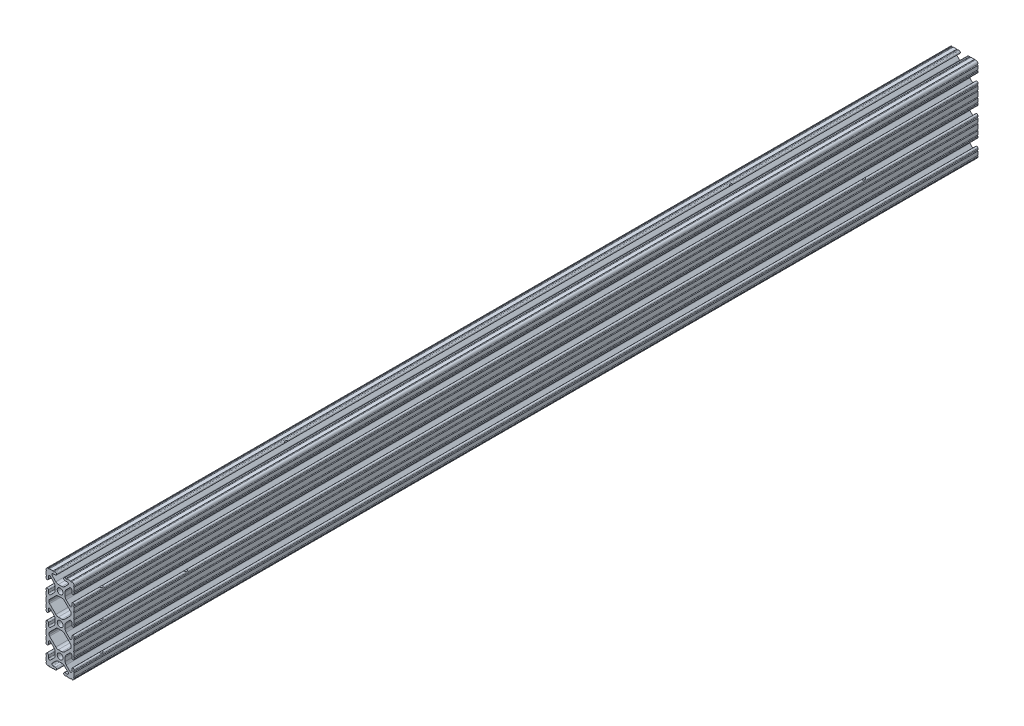
from build123d import *

# Parameters (mm, degrees)
SKETCH1_R               = 2.6035
BOSS_EXTRUDE1_DEPTH     = 406.4
CUT_EXTRUDE1_DEPTH      = 409.544636002
CUT_EXTRUDE1_DEPTH_BACK = 409.544636002
SKETCH2_R               = 3.5
CUT_EXTRUDE2_DEPTH      = 409.544636102
CUT_EXTRUDE2_DEPTH_BACK = 409.544636102
SKETCH3_R               = 3.5
CUT_EXTRUDE3_DEPTH      = 413.246808546
CUT_EXTRUDE3_DEPTH_BACK = 413.246808546
SKETCH4_R               = 3.5


with BuildPart() as part:
    # Sketch1 → Boss-Extrude1 (new, symmetric)
    with BuildSketch(Plane.XY):
        with BuildLine():
            Line((-12.7, 34.9504), (-12.7, 31.7246))
            ThreePointArc((-12.7, 31.7246), (-12.192, 31.2166), (-12.7, 30.7086))
            Line((-12.7, 30.7086), (-12.7, 29.702307889))
            ThreePointArc((-12.7, 29.702307889), (-11.5951, 28.597407889), (-10.4902, 29.702307889))
            Line((-10.4902, 29.702307889), (-10.4902, 31.874794456))
            ThreePointArc((-10.4902, 31.874794456), (-9.863006367, 32.813456061), (-8.75577951, 32.593214945))
            Line((-8.75577951, 32.593214945), (-5.43843597, 29.275871405))
            ThreePointArc((-5.43843597, 29.275871405), (-4.750182484, 28.245827272), (-4.5085, 27.030807374))
            Line((-4.5085, 27.030807374), (-4.5085, 23.769192626))
            ThreePointArc((-4.5085, 23.769192626), (-4.750182484, 22.554172728), (-5.43843597, 21.524128595))
            Line((-5.43843597, 21.524128595), (-8.75577951, 18.206785055))
            ThreePointArc((-8.75577951, 18.206785055), (-9.863006367, 17.986543939), (-10.4902, 18.925205544))
            Line((-10.4902, 18.925205544), (-10.4902, 21.097692111))
            ThreePointArc((-10.4902, 21.097692111), (-11.5951, 22.202592111), (-12.7, 21.097692111))
            Line((-12.7, 21.097692111), (-12.7, 20.0914))
            ThreePointArc((-12.7, 20.0914), (-12.192, 19.5834), (-12.7, 19.0754))
            Line((-12.7, 19.0754), (-12.7, 15.8496))
            ThreePointArc((-12.7, 15.8496), (-12.192, 15.3416), (-12.7, 14.8336))
            Line((-12.7, 14.8336), (-12.7, 10.5664))
            ThreePointArc((-12.7, 10.5664), (-12.192, 10.0584), (-12.7, 9.5504))
            Line((-12.7, 9.5504), (-12.7, 6.3246))
            ThreePointArc((-12.7, 6.3246), (-12.192000017, 5.8166), (-12.7, 5.3086))
            Line((-12.7, 5.3086), (-12.7, 4.302307889))
            ThreePointArc((-12.7, 4.302307889), (-11.5951, 3.197407889), (-10.4902, 4.302307889))
            Line((-10.4902, 4.302307889), (-10.4902, 6.474794456))
            ThreePointArc((-10.4902, 6.474794456), (-9.863006367, 7.413456061), (-8.75577951, 7.193214945))
            Line((-8.75577951, 7.193214945), (-5.43843597, 3.875871405))
            ThreePointArc((-5.43843597, 3.875871405), (-4.750182484, 2.845827272), (-4.5085, 1.630807374))
            Line((-4.5085, 1.630807374), (-4.5085, -1.630807374))
            ThreePointArc((-4.5085, -1.630807374), (-4.750182484, -2.845827272), (-5.43843597, -3.875871405))
            Line((-5.43843597, -3.875871405), (-8.75577951, -7.193214945))
            ThreePointArc((-8.75577951, -7.193214945), (-9.863006367, -7.413456061), (-10.4902, -6.474794456))
            Line((-10.4902, -6.474794456), (-10.4902, -4.302307889))
            ThreePointArc((-10.4902, -4.302307889), (-11.5951, -3.197407889), (-12.7, -4.302307889))
            Line((-12.7, -4.302307889), (-12.7, -5.3086))
            ThreePointArc((-12.7, -5.3086), (-12.191999983, -5.8166), (-12.7, -6.3246))
            Line((-12.7, -6.3246), (-12.7, -9.5504))
            ThreePointArc((-12.7, -9.5504), (-12.192, -10.0584), (-12.7, -10.5664))
            Line((-12.7, -10.5664), (-12.7, -14.8336))
            ThreePointArc((-12.7, -14.8336), (-12.192, -15.3416), (-12.7, -15.8496))
            Line((-12.7, -15.8496), (-12.7, -19.0754))
            ThreePointArc((-12.7, -19.0754), (-12.192, -19.5834), (-12.7, -20.0914))
            Line((-12.7, -20.0914), (-12.7, -21.097692111))
            ThreePointArc((-12.7, -21.097692111), (-11.5951, -22.202592111), (-10.4902, -21.097692111))
            Line((-10.4902, -21.097692111), (-10.4902, -18.925205544))
            ThreePointArc((-10.4902, -18.925205544), (-9.863006367, -17.986543939), (-8.75577951, -18.206785055))
            Line((-8.75577951, -18.206785055), (-5.43843597, -21.524128595))
            ThreePointArc((-5.43843597, -21.524128595), (-4.750182484, -22.554172728), (-4.5085, -23.769192626))
            Line((-4.5085, -23.769192626), (-4.5085, -27.030807374))
            ThreePointArc((-4.5085, -27.030807374), (-4.750182484, -28.245827272), (-5.43843597, -29.275871405))
            Line((-5.43843597, -29.275871405), (-8.75577951, -32.593214945))
            ThreePointArc((-8.75577951, -32.593214945), (-9.863006367, -32.813456061), (-10.4902, -31.874794456))
            Line((-10.4902, -31.874794456), (-10.4902, -29.702307889))
            ThreePointArc((-10.4902, -29.702307889), (-11.5951, -28.597407889), (-12.7, -29.702307889))
            Line((-12.7, -29.702307889), (-12.7, -30.7086))
            ThreePointArc((-12.7, -30.7086), (-12.192, -31.2166), (-12.7, -31.7246))
            Line((-12.7, -31.7246), (-12.7, -34.9504))
            ThreePointArc((-12.7, -34.9504), (-12.192, -35.4584), (-12.7, -35.9664))
            ThreePointArc((-12.7, -35.9664), (-12.082677406, -37.482677406), (-10.5664, -38.1))
            ThreePointArc((-10.5664, -38.1), (-10.0584, -37.592), (-9.5504, -38.1))
            Line((-9.5504, -38.1), (-6.3246, -38.1))
            ThreePointArc((-6.3246, -38.1), (-5.816599996, -37.592000017), (-5.3086, -38.100000008))
            Line((-5.3086, -38.100000008), (-4.302307889, -38.100000008))
            ThreePointArc((-4.302307889, -38.100000008), (-3.197407889, -36.995100008), (-4.302307889, -35.890200008))
            Line((-4.302307889, -35.890200008), (-6.474794456, -35.890200008))
            ThreePointArc((-6.474794456, -35.890200008), (-7.413456061, -35.263006376), (-7.193214945, -34.155779519))
            Line((-7.193214945, -34.155779519), (-3.875871405, -30.838435978))
            ThreePointArc((-3.875871405, -30.838435978), (-2.845827272, -30.150182493), (-1.630807374, -29.908500008))
            Line((-1.630807374, -29.908500008), (1.630807374, -29.908500008))
            ThreePointArc((1.630807374, -29.908500008), (2.845827272, -30.150182493), (3.875871405, -30.838435978))
            Line((3.875871405, -30.838435978), (7.193214945, -34.155779519))
            ThreePointArc((7.193214945, -34.155779519), (7.413456061, -35.263006376), (6.474794456, -35.890200008))
            Line((6.474794456, -35.890200008), (4.302307889, -35.890200008))
            ThreePointArc((4.302307889, -35.890200008), (3.197407889, -36.995100008), (4.302307889, -38.100000008))
            Line((4.302307889, -38.100000008), (5.3086, -38.100000008))
            ThreePointArc((5.3086, -38.100000008), (5.8166, -37.591999992), (6.3246, -38.100000008))
            Line((6.3246, -38.100000008), (9.5504, -38.100000008))
            ThreePointArc((9.5504, -38.100000008), (10.0584, -37.592000008), (10.5664, -38.100000008))
            ThreePointArc((10.5664, -38.100000008), (12.082677406, -37.482677414), (12.7, -35.966400008))
            ThreePointArc((12.7, -35.966400008), (12.192, -35.458400008), (12.7, -34.950400008))
            Line((12.7, -34.950400008), (12.7, -31.724600008))
            ThreePointArc((12.7, -31.724600008), (12.192, -31.216600008), (12.7, -30.708600008))
            Line((12.7, -30.708600008), (12.7, -29.702307926))
            ThreePointArc((12.7, -29.702307926), (11.5951, -28.597407926), (10.4902, -29.702307926))
            Line((10.4902, -29.702307926), (10.4902, -31.874794464))
            ThreePointArc((10.4902, -31.874794464), (9.863006367, -32.813456069), (8.75577951, -32.593214954))
            Line((8.75577951, -32.593214954), (5.43843597, -29.275871413))
            ThreePointArc((5.43843597, -29.275871413), (4.750182484, -28.245827281), (4.5085, -27.030807383))
            Line((4.5085, -27.030807383), (4.5085, -23.769192634))
            ThreePointArc((4.5085, -23.769192634), (4.750182484, -22.554172736), (5.43843597, -21.524128604))
            Line((5.43843597, -21.524128604), (8.75577951, -18.206785063))
            ThreePointArc((8.75577951, -18.206785063), (9.863006367, -17.986543948), (10.4902, -18.925205553))
            Line((10.4902, -18.925205553), (10.4902, -21.097692067))
            ThreePointArc((10.4902, -21.097692067), (11.5951, -22.202592067), (12.7, -21.097692067))
            Line((12.7, -21.097692067), (12.7, -20.091400008))
            ThreePointArc((12.7, -20.091400008), (12.192, -19.583400008), (12.7, -19.075400008))
            Line((12.7, -19.075400008), (12.7, -15.849600008))
            ThreePointArc((12.7, -15.849600008), (12.192, -15.341600008), (12.7, -14.833600008))
            Line((12.7, -14.833600008), (12.7, -10.566400008))
            ThreePointArc((12.7, -10.566400008), (12.192, -10.058400008), (12.7, -9.550400008))
            Line((12.7, -9.550400008), (12.7, -6.324600008))
            ThreePointArc((12.7, -6.324600008), (12.192000017, -5.816600008), (12.7, -5.308600008))
            Line((12.7, -5.308600008), (12.7, -4.302307897))
            ThreePointArc((12.7, -4.302307897), (11.5951, -3.197407897), (10.4902, -4.302307897))
            Line((10.4902, -4.302307897), (10.4902, -6.474794464))
            ThreePointArc((10.4902, -6.474794464), (9.863006367, -7.413456069), (8.75577951, -7.193214954))
            Line((8.75577951, -7.193214954), (5.43843597, -3.875871413))
            ThreePointArc((5.43843597, -3.875871413), (4.750182484, -2.845827281), (4.5085, -1.630807383))
            Line((4.5085, -1.630807383), (4.5085, 1.630807366))
            ThreePointArc((4.5085, 1.630807366), (4.750182484, 2.845827264), (5.43843597, 3.875871396))
            Line((5.43843597, 3.875871396), (8.75577951, 7.193214937))
            ThreePointArc((8.75577951, 7.193214937), (9.863006367, 7.413456052), (10.4902, 6.474794447))
            Line((10.4902, 6.474794447), (10.4902, 4.302307881))
            ThreePointArc((10.4902, 4.302307881), (11.5951, 3.197407881), (12.7, 4.302307881))
            Line((12.7, 4.302307881), (12.7, 5.308599992))
            ThreePointArc((12.7, 5.308599992), (12.191999983, 5.816599992), (12.7, 6.324599992))
            Line((12.7, 6.324599992), (12.7, 9.550399992))
            ThreePointArc((12.7, 9.550399992), (12.192, 10.058399992), (12.7, 10.566399992))
            Line((12.7, 10.566399992), (12.7, 14.833599992))
            ThreePointArc((12.7, 14.833599992), (12.192, 15.341599992), (12.7, 15.849599992))
            Line((12.7, 15.849599992), (12.7, 19.075399992))
            ThreePointArc((12.7, 19.075399992), (12.192, 19.583399992), (12.7, 20.091399992))
            Line((12.7, 20.091399992), (12.7, 21.097692074))
            ThreePointArc((12.7, 21.097692074), (11.5951, 22.202592074), (10.4902, 21.097692074))
            Line((10.4902, 21.097692074), (10.4902, 18.925205536))
            ThreePointArc((10.4902, 18.925205536), (9.863006367, 17.986543931), (8.75577951, 18.206785046))
            Line((8.75577951, 18.206785046), (5.43843597, 21.524128587))
            ThreePointArc((5.43843597, 21.524128587), (4.750182484, 22.554172719), (4.5085, 23.769192617))
            Line((4.5085, 23.769192617), (4.5085, 27.030807366))
            ThreePointArc((4.5085, 27.030807366), (4.750182484, 28.245827264), (5.43843597, 29.275871396))
            Line((5.43843597, 29.275871396), (8.75577951, 32.593214937))
            ThreePointArc((8.75577951, 32.593214937), (9.863006367, 32.813456052), (10.4902, 31.874794447))
            Line((10.4902, 31.874794447), (10.4902, 29.702307881))
            ThreePointArc((10.4902, 29.702307881), (11.5951, 28.597407881), (12.7, 29.702307881))
            Line((12.7, 29.702307881), (12.7, 30.708599992))
            ThreePointArc((12.7, 30.708599992), (12.192, 31.216599992), (12.7, 31.724599992))
            Line((12.7, 31.724599992), (12.7, 34.9504))
            ThreePointArc((12.7, 34.9504), (12.192, 35.4584), (12.7, 35.9664))
            ThreePointArc((12.7, 35.9664), (12.082677406, 37.482677406), (10.5664, 38.1))
            ThreePointArc((10.5664, 38.1), (10.0584, 37.592), (9.5504, 38.1))
            Line((9.5504, 38.1), (6.3246, 38.1))
            ThreePointArc((6.3246, 38.1), (5.8166, 37.591999983), (5.3086, 38.1))
            Line((5.3086, 38.1), (4.302307889, 38.1))
            ThreePointArc((4.302307889, 38.1), (3.197407889, 36.9951), (4.302307889, 35.8902))
            Line((4.302307889, 35.8902), (6.474794456, 35.8902))
            ThreePointArc((6.474794456, 35.8902), (7.413456061, 35.263006367), (7.193214945, 34.15577951))
            Line((7.193214945, 34.15577951), (3.875871405, 30.83843597))
            ThreePointArc((3.875871405, 30.83843597), (2.845827272, 30.150182484), (1.630807374, 29.9085))
            Line((1.630807374, 29.9085), (-1.630807374, 29.9085))
            ThreePointArc((-1.630807374, 29.9085), (-2.845827272, 30.150182484), (-3.875871405, 30.83843597))
            Line((-3.875871405, 30.83843597), (-7.193214945, 34.15577951))
            ThreePointArc((-7.193214945, 34.15577951), (-7.413456061, 35.263006367), (-6.474794456, 35.8902))
            Line((-6.474794456, 35.8902), (-4.302307889, 35.8902))
            ThreePointArc((-4.302307889, 35.8902), (-3.197407889, 36.9951), (-4.302307889, 38.1))
            Line((-4.302307889, 38.1), (-5.3086, 38.1))
            ThreePointArc((-5.3086, 38.1), (-5.8166, 37.592000017), (-6.3246, 38.1))
            Line((-6.3246, 38.1), (-9.5504, 38.1))
            ThreePointArc((-9.5504, 38.1), (-10.0584, 37.592), (-10.5664, 38.1))
            ThreePointArc((-10.5664, 38.1), (-12.082677406, 37.482677406), (-12.7, 35.9664))
            ThreePointArc((-12.7, 35.9664), (-12.192, 35.4584), (-12.7, 34.9504))
        make_face()
        with Locations((0, -25.4)):
            Circle(SKETCH1_R, mode=Mode.SUBTRACT)
        Circle(SKETCH1_R, mode=Mode.SUBTRACT)
        with Locations((0, 25.4)):
            Circle(SKETCH1_R, mode=Mode.SUBTRACT)
        with BuildLine():
            Line((-9.9314, -12.146268083), (-9.9314, -13.253731917))
            ThreePointArc((-9.9314, -13.253731917), (-9.811525488, -13.856381786), (-9.470151759, -14.367283676))
            Line((-9.470151759, -14.367283676), (-3.875871405, -19.96156403))
            ThreePointArc((-3.875871405, -19.96156403), (-2.845827272, -20.649817516), (-1.630807374, -20.8915))
            Line((-1.630807374, -20.8915), (1.630807374, -20.8915))
            ThreePointArc((1.630807374, -20.8915), (2.845827272, -20.649817516), (3.875871405, -19.96156403))
            Line((3.875871405, -19.96156403), (9.470151759, -14.367283676))
            ThreePointArc((9.470151759, -14.367283676), (9.811525488, -13.856381786), (9.9314, -13.253731917))
            Line((9.9314, -13.253731917), (9.9314, -12.146268083))
            ThreePointArc((9.9314, -12.146268083), (9.811525488, -11.543618214), (9.470151759, -11.032716324))
            Line((9.470151759, -11.032716324), (3.875871405, -5.43843597))
            ThreePointArc((3.875871405, -5.43843597), (2.845827272, -4.750182484), (1.630807374, -4.5085))
            Line((1.630807374, -4.5085), (-1.630807374, -4.5085))
            ThreePointArc((-1.630807374, -4.5085), (-2.845827272, -4.750182484), (-3.875871405, -5.43843597))
            Line((-3.875871405, -5.43843597), (-9.470151759, -11.032716324))
            ThreePointArc((-9.470151759, -11.032716324), (-9.811525488, -11.543618214), (-9.9314, -12.146268083))
        make_face(mode=Mode.SUBTRACT)
        with BuildLine():
            Line((-9.9314, 13.253731917), (-9.9314, 12.146268083))
            ThreePointArc((-9.9314, 12.146268083), (-9.811525488, 11.543618214), (-9.470151759, 11.032716324))
            Line((-9.470151759, 11.032716324), (-3.875871405, 5.43843597))
            ThreePointArc((-3.875871405, 5.43843597), (-2.845827272, 4.750182484), (-1.630807374, 4.5085))
            Line((-1.630807374, 4.5085), (1.630807374, 4.5085))
            ThreePointArc((1.630807374, 4.5085), (2.845827272, 4.750182484), (3.875871405, 5.43843597))
            Line((3.875871405, 5.43843597), (9.470151759, 11.032716324))
            ThreePointArc((9.470151759, 11.032716324), (9.811525488, 11.543618214), (9.9314, 12.146268083))
            Line((9.9314, 12.146268083), (9.9314, 13.253731917))
            ThreePointArc((9.9314, 13.253731917), (9.811525488, 13.856381786), (9.470151759, 14.367283676))
            Line((9.470151759, 14.367283676), (3.875871405, 19.96156403))
            ThreePointArc((3.875871405, 19.96156403), (2.845827272, 20.649817516), (1.630807374, 20.8915))
            Line((1.630807374, 20.8915), (-1.630807374, 20.8915))
            ThreePointArc((-1.630807374, 20.8915), (-2.845827272, 20.649817516), (-3.875871405, 19.96156403))
            Line((-3.875871405, 19.96156403), (-9.470151759, 14.367283676))
            ThreePointArc((-9.470151759, 14.367283676), (-9.811525488, 13.856381786), (-9.9314, 13.253731917))
        make_face(mode=Mode.SUBTRACT)
    extrude(amount=BOSS_EXTRUDE1_DEPTH, both=True)

    # Sketch2 → Cut-Extrude1 (cut, two sides: drawn at the far end of the back side and taken through both)
    with BuildSketch(Plane(origin=(4.5085, 0, 0), x_dir=(0, 0, -1), z_dir=(1, 0, 0)).offset(-CUT_EXTRUDE1_DEPTH_BACK)):
        with Locations((-381, 25.4)):
            Circle(SKETCH2_R)
        with Locations((-381, 0)):
            Circle(SKETCH2_R)
        with Locations((-381, -25.4)):
            Circle(SKETCH2_R)
    extrude(amount=CUT_EXTRUDE1_DEPTH + CUT_EXTRUDE1_DEPTH_BACK, mode=Mode.SUBTRACT)

    # Sketch3 → Cut-Extrude2 (cut, two sides: drawn at the far end of the back side and taken through both)
    with BuildSketch(Plane(origin=(4.5085, 0, 0), x_dir=(0, 0, -1), z_dir=(1, 0, 0)).offset(-CUT_EXTRUDE2_DEPTH_BACK)):
        with Locations((-304.8, 0)):
            Circle(SKETCH3_R)
        with Locations((304.8, 0)):
            Circle(SKETCH3_R)
    extrude(amount=CUT_EXTRUDE2_DEPTH + CUT_EXTRUDE2_DEPTH_BACK, mode=Mode.SUBTRACT)

    # Sketch4 → Cut-Extrude3 (cut, two sides: drawn at the far end of the back side and taken through both)
    with BuildSketch(Plane.XZ.offset(29.908500008).offset(-CUT_EXTRUDE3_DEPTH_BACK)):
        with Locations((0, 200)):
            Circle(SKETCH4_R)
        with Locations((0, -200)):
            Circle(SKETCH4_R)
    extrude(amount=CUT_EXTRUDE3_DEPTH + CUT_EXTRUDE3_DEPTH_BACK, mode=Mode.SUBTRACT)


solid = part.part
